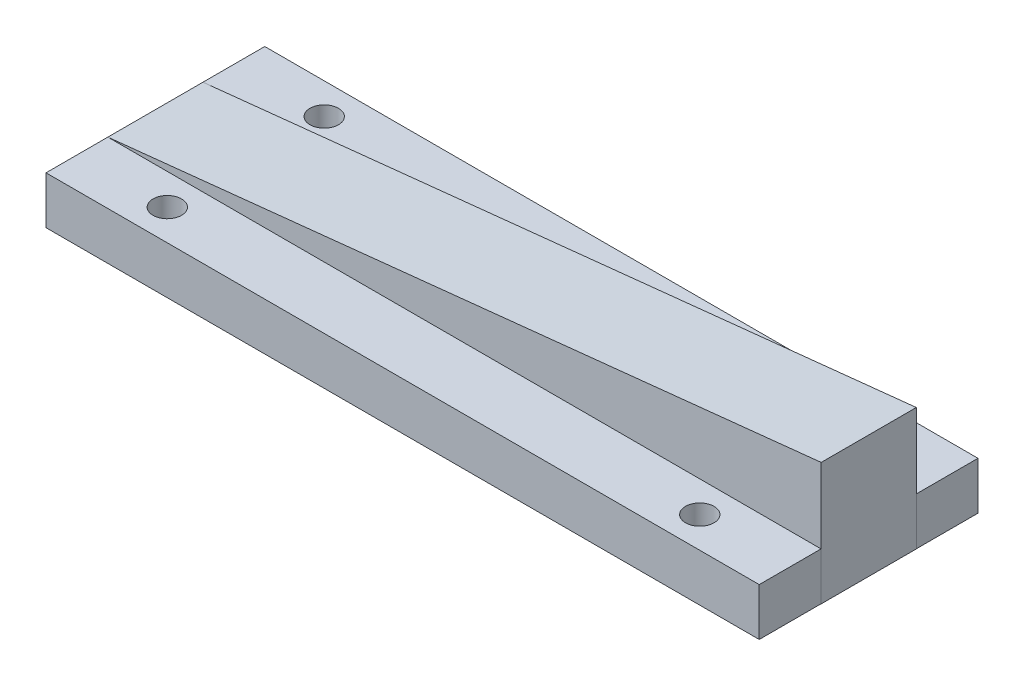
from build123d import *

# Parameters (mm, degrees)
SKETCH1_W           = 150
SKETCH1_H           = 20
BOSS_EXTRUDE1_DEPTH = 10
BOSS_EXTRUDE2_DEPTH = 10
SKETCH3_W           = 149.970542341
SKETCH3_H           = 10
BOSS_EXTRUDE3_DEPTH = 23
SKETCH4_R           = 3
CUT_EXTRUDE1_DEPTH  = 46


with BuildPart() as part:
    # Sketch1 → Boss-Extrude1 (new body)
    with BuildSketch(Plane(origin=(0, 0, 0), x_dir=(1, 0, 0), z_dir=(0, 1, 0))):
        Rectangle(SKETCH1_W, SKETCH1_H)
    extrude(amount=BOSS_EXTRUDE1_DEPTH)

    # Sketch2 → Boss-Extrude2 (add, symmetric)
    with BuildSketch(Plane.XY):
        Polygon((-75, 10), (75, 10), (75, 25.76563529), align=None)
    extrude(amount=BOSS_EXTRUDE2_DEPTH, both=True)

    # Sketch3 → Boss-Extrude3 (add, symmetric)
    with BuildSketch(Plane(origin=(0, 0, 0), x_dir=(-1, 0, 0), z_dir=(0, 0, -1))):
        with Locations((0.01472883, 5)):
            Rectangle(SKETCH3_W, SKETCH3_H)
    extrude(amount=BOSS_EXTRUDE3_DEPTH, both=True)

    # Sketch4 → Cut-Extrude1 (cut)
    with BuildSketch(Plane(origin=(0, 10, 0), x_dir=(1, 0, 0), z_dir=(0, 1, 0))):
        with Locations((-56, 16.5)):
            Circle(SKETCH4_R)
        with Locations((55.970542341, 16.5)):
            Circle(SKETCH4_R)
        with Locations((55.970542341, -16.5)):
            Circle(SKETCH4_R)
        with Locations((-56, -16.5)):
            Circle(SKETCH4_R)
    extrude(amount=-CUT_EXTRUDE1_DEPTH, mode=Mode.SUBTRACT)


solid = part.part
